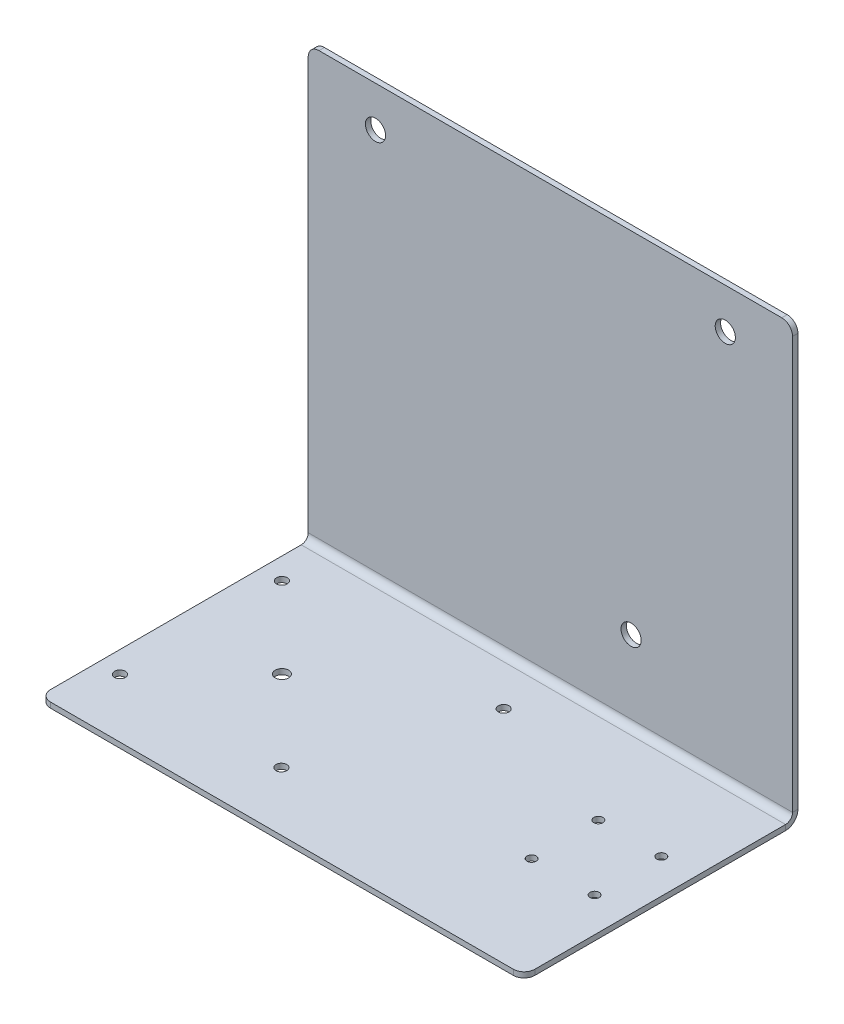
from build123d import *

# Parameters (mm, degrees)
BOSS_EXTRUDE1_DEPTH      = 2.54
SKETCHED_START           = -165.1
SKETCHED_BEND1_OUTLINE_W = 228.6
SKETCHED_BEND1_OUTLINE_H = 2.54
SKETCHED_BEND1_DEPTH     = 125.300208363
SKETCHED_START_2         = -40.351159597
SKETCHED_BEND1_2_DEPTH   = 4.05656796
SKETCHED_START_3         = -114.3
SKETCHED_BEND1_3_DEPTH   = 228.6
SKETCHED_BEND1_4_DEPTH   = 228.6
SKETCH8_R                = 2.54
SKETCH8_R_2              = 3.175
SKETCH8_R_3              = 2.159
CUT_EXTRUDE2_DEPTH       = 2.54
SKETCH29_R               = 4.7625
CUT_EXTRUDE3_DEPTH       = 2.54


with BuildPart() as part:
    # Sketch2 → Boss-Extrude1 (new body)
    with BuildSketch(Plane.XY):
        with BuildLine():
            Line((109.22, -165.1), (-109.22, -165.1))
            ThreePointArc((-109.22, -165.1), (-112.812102448, -163.612102448), (-114.3, -160.02))
            Line((-114.3, -160.02), (-114.3, 160.02))
            ThreePointArc((-114.3, 160.02), (-112.812102448, 163.612102448), (-109.22, 165.1))
            Line((-109.22, 165.1), (109.22, 165.1))
            ThreePointArc((109.22, 165.1), (112.812102448, 163.612102448), (114.3, 160.02))
            Line((114.3, 160.02), (114.3, -160.02))
            ThreePointArc((114.3, -160.02), (112.812102448, -163.612102448), (109.22, -165.1))
        make_face()
    extrude(amount=BOSS_EXTRUDE1_DEPTH)

    # Sketched Bend1: read off the stored shape, not the designer's step
    # Sketched Bend1 outline → Sketched Bend1 (cut)
    with BuildSketch(Plane(origin=(0, 0, 0), x_dir=(1, 0, 0), z_dir=(0, 1, 0)).offset(SKETCHED_START)):
        with Locations((0, -1.27)):
            Rectangle(SKETCHED_BEND1_OUTLINE_W, SKETCHED_BEND1_OUTLINE_H)
    extrude(amount=SKETCHED_BEND1_DEPTH, mode=Mode.SUBTRACT)

    # Sketched Bend1 2 outline → Sketched Bend1 2 (add)
    with BuildSketch(Plane(origin=(0, 0, 0), x_dir=(1, 0, 0), z_dir=(0, 1, 0)).offset(SKETCHED_START_2)):
        with BuildLine():
            Line((114.3, -124.171159597), (114.3, -2.54))
            Line((114.3, -2.54), (-114.3, -2.54))
            Line((-114.3, -2.54), (-114.3, -124.171159597))
            ThreePointArc((-114.3, -124.171159597), (-112.812102448, -127.763262045), (-109.22, -129.251159597))
            Line((-109.22, -129.251159597), (109.22, -129.251159597))
            ThreePointArc((109.22, -129.251159597), (112.812102448, -127.763262045), (114.3, -124.171159597))
        make_face()
    extrude(amount=SKETCHED_BEND1_2_DEPTH)

    # Sketched Bend1 3 outline → Sketched Bend1 3 (cut)
    with BuildSketch(Plane.YZ.offset(SKETCHED_START_3)):
        with BuildLine():
            Line((-36.294591637, 129.251159597), (-37.811159597, 129.251159597))
            Line((-37.811159597, 129.251159597), (-37.811159597, 5.842))
            ThreePointArc((-37.811159597, 5.842), (-37.407322859, 4.259642992), (-36.294591637, 3.064332557))
            Line((-36.294591637, 3.064332557), (-36.294591637, 129.251159597))
        make_face()
        with BuildLine():
            ThreePointArc((-34.509159597, 0), (-38.640077413, 1.711082184), (-40.351159597, 5.842))
            Line((-40.351159597, 5.842), (-40.351159597, 2.54))
            Line((-40.351159597, 2.54), (-39.799791637, 2.54))
            Line((-39.799791637, 2.54), (-39.799791637, 0))
            Line((-39.799791637, 0), (-34.509159597, 0))
        make_face()
    extrude(amount=SKETCHED_BEND1_3_DEPTH, mode=Mode.SUBTRACT)

    # Sketched Bend1 4 outline → Sketched Bend1 4 (add)
    with BuildSketch(Plane.YZ.offset(SKETCHED_START_3)):
        with BuildLine():
            ThreePointArc((-34.509159597, 2.54), (-35.439575122, 2.673793733), (-36.294591637, 3.064332557))
            Line((-36.294591637, 3.064332557), (-36.294591637, 2.54))
            Line((-36.294591637, 2.54), (-34.509159597, 2.54))
        make_face()
    extrude(amount=SKETCHED_BEND1_4_DEPTH)

    # Sketch8 → Cut-Extrude2 (cut)
    with BuildSketch(Plane(origin=(0, -37.811159597, 0), x_dir=(1, 0, 0), z_dir=(0, 1, 0))):
        with Locations(Location((-104.14, -25.111159597, 0), (0, 0, 270))):
            Circle(SKETCH8_R)
        with Locations(Location((0.508, -25.111159597, 0), (0, 0, 270))):
            Circle(SKETCH8_R)
        with Locations(Location((-104.14, -101.565159597, 0), (0, 0, 270))):
            Circle(SKETCH8_R)
        with Locations(Location((-27.94, -101.565159597, 0), (0, 0, 270))):
            Circle(SKETCH8_R)
        with Locations(Location((-66.04, -63.211159597, 0), (0, 0, 270))):
            Circle(SKETCH8_R_2)
        with Locations(Location((68.326, -48.225159597, 0), (0, 0, 270))):
            Circle(SKETCH8_R_3)
        with Locations(Location((98.044, -48.225159597, 0), (0, 0, 270))):
            Circle(SKETCH8_R_3)
        with Locations(Location((98.044, -79.721159597, 0), (0, 0, 270))):
            Circle(SKETCH8_R_3)
        with Locations(Location((68.326, -79.721159597, 0), (0, 0, 270))):
            Circle(SKETCH8_R_3)
    extrude(amount=-CUT_EXTRUDE2_DEPTH, mode=Mode.SUBTRACT)

    # Sketch29 → Cut-Extrude3 (cut)
    with BuildSketch(Plane.XY.offset(2.54)):
        with Locations((-82.55, 146.05)):
            Circle(SKETCH29_R)
        with Locations((82.55, 146.05)):
            Circle(SKETCH29_R)
        with Locations((38.1, 0)):
            Circle(SKETCH29_R)
    extrude(amount=-CUT_EXTRUDE3_DEPTH, mode=Mode.SUBTRACT)


solid = part.part
